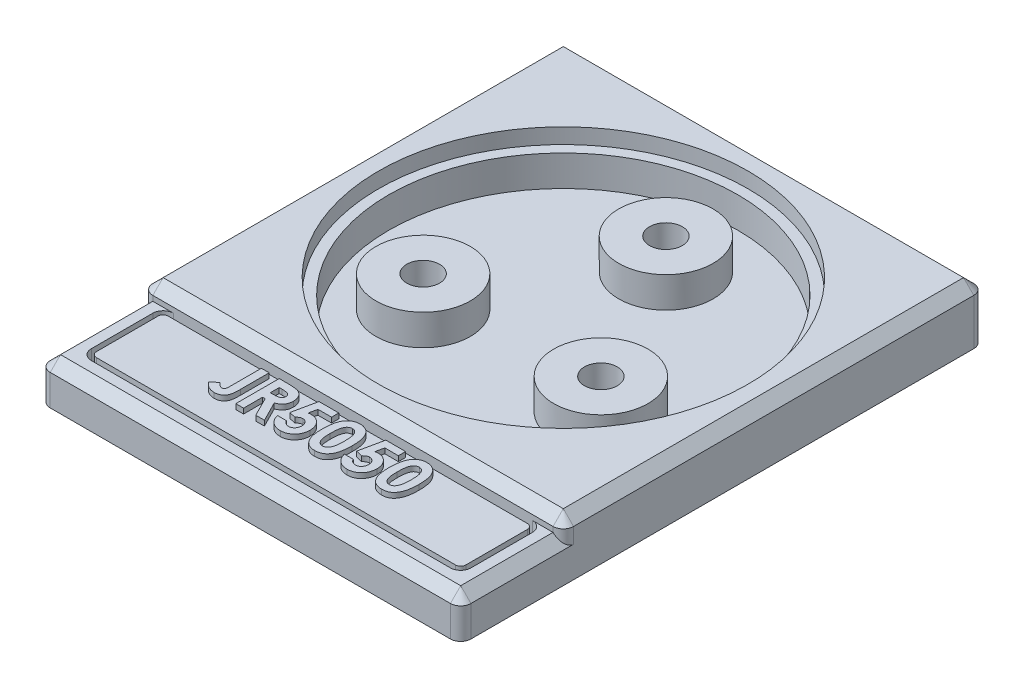
from build123d import *

# Parameters (mm, degrees)
SKETCH3_W           = 41
SKETCH3_H           = 41
SKETCH3_W_2         = 37
SKETCH3_H_2         = 37
SKETCH3_R           = 18
SKETCH3_W_3         = 35
SKETCH3_H_3         = 35
SKETCH3_R_2         = 17
SKETCH3_H_4         = 8
BOSS_EXTRUDE1_DEPTH = 1
BOSS_EXTRUDE2_START = 1
SKETCH3_3_W         = 41
SKETCH3_3_H         = 51
SKETCH3_3_R         = 17
SKETCH3_3_W_2       = 37
SKETCH3_3_H_2       = 8
BOSS_EXTRUDE2_DEPTH = 3
BOSS_EXTRUDE3_START = 4
SKETCH3_4_W         = 41
SKETCH3_4_H         = 41
SKETCH3_4_W_2       = 37
SKETCH3_4_H_2       = 37
SKETCH3_4_R         = 18
BOSS_EXTRUDE3_DEPTH = 1.5
SKETCH4_R           = 4.6
SKETCH4_R_2         = 1.6
BOSS_EXTRUDE4_DEPTH = 3
FILLET1_R           = 1
CHAMFER1_SIZE       = 1
BOSS_EXTRUDE5_START = 0.5
BOSS_EXTRUDE5_DEPTH = 2.5
BOSS_EXTRUDE6_DEPTH = 0.5


with BuildPart() as part:
    # Sketch3 → Boss-Extrude1 (new body)
    # profile 1 of 7: a face of its own
    with BuildSketch(Plane(origin=(0, 0, 0), x_dir=(1, 0, 0), z_dir=(0, 1, 0))):
        Rectangle(SKETCH3_W, SKETCH3_H)
        Rectangle(SKETCH3_W_2, SKETCH3_H_2, mode=Mode.SUBTRACT)
    # profile 2 of 7: a face of its own
    with BuildSketch(Plane(origin=(0, 0, 0), x_dir=(1, 0, 0), z_dir=(0, 1, 0))):
        Rectangle(SKETCH3_W_2, SKETCH3_H_2)
        Circle(SKETCH3_R, mode=Mode.SUBTRACT)
    # profile 3 of 7: a face of its own
    with BuildSketch(Plane(origin=(0, 0, 0), x_dir=(1, 0, 0), z_dir=(0, 1, 0))):
        Rectangle(SKETCH3_W_3, SKETCH3_H_3)
    # profile 4 of 7: a face of its own
    with BuildSketch(Plane(origin=(0, 0, 0), x_dir=(1, 0, 0), z_dir=(0, 1, 0))):
        Circle(SKETCH3_R)
        Circle(SKETCH3_R_2, mode=Mode.SUBTRACT)
    # profile 5 of 7: a face of its own
    with BuildSketch(Plane(origin=(0, 0, 0), x_dir=(1, 0, 0), z_dir=(0, 1, 0))):
        Circle(SKETCH3_R_2)
    # profile 6 of 7: a face of its own
    with BuildSketch(Plane(origin=(0, 0, 0), x_dir=(1, 0, 0), z_dir=(0, 1, 0))):
        with Locations((0, -24.5)):
            Rectangle(SKETCH3_W_2, SKETCH3_H_4)
    # profile 7 of 7: a face of its own
    with BuildSketch(Plane(origin=(0, 0, 0), x_dir=(1, 0, 0), z_dir=(0, 1, 0))):
        Polygon((-18.5, -20.5), (-20.5, -20.5), (-20.5, -30.5), (20.5, -30.5), (20.5, -20.5), (18.5, -20.5), (18.5, -28.5), (-18.5, -28.5), align=None)
    extrude(amount=BOSS_EXTRUDE1_DEPTH)

    # Sketch3<3> → Boss-Extrude2 (add)
    with BuildSketch(Plane(origin=(0, 0, 0), x_dir=(1, 0, 0), z_dir=(0, 1, 0)).offset(BOSS_EXTRUDE2_START)):
        with Locations((0, -5)):
            Rectangle(SKETCH3_3_W, SKETCH3_3_H)
        with Locations(Location((0, 0, 0), (0, 0, 270))):
            Circle(SKETCH3_3_R, mode=Mode.SUBTRACT)
        with Locations((0, -24.5)):
            Rectangle(SKETCH3_3_W_2, SKETCH3_3_H_2, mode=Mode.SUBTRACT)
    extrude(amount=BOSS_EXTRUDE2_DEPTH)

    # Sketch3<4> → Boss-Extrude3 (add)
    # profile 1 of 2: a face of its own
    with BuildSketch(Plane(origin=(0, 0, 0), x_dir=(1, 0, 0), z_dir=(0, 1, 0)).offset(BOSS_EXTRUDE3_START)):
        Rectangle(SKETCH3_4_W, SKETCH3_4_H)
        Rectangle(SKETCH3_4_W_2, SKETCH3_4_H_2, mode=Mode.SUBTRACT)
    # profile 2 of 2: a face of its own
    with BuildSketch(Plane(origin=(0, 0, 0), x_dir=(1, 0, 0), z_dir=(0, 1, 0)).offset(BOSS_EXTRUDE3_START)):
        Rectangle(SKETCH3_4_W_2, SKETCH3_4_H_2)
        with Locations(Location((0, 0, 0), (0, 0, 90))):
            Circle(SKETCH3_4_R, mode=Mode.SUBTRACT)
    extrude(amount=BOSS_EXTRUDE3_DEPTH)

    # Sketch4 → Boss-Extrude4 (add)
    # profile 1 of 3: a face of its own
    with BuildSketch(Plane(origin=(0, 1, 0), x_dir=(1, 0, 0), z_dir=(0, 1, 0))):
        with Locations(Location((0, 10, 0), (0, 0, 90))):
            Circle(SKETCH4_R)
        with Locations(Location((0, 10, 0), (0, 0, 90))):
            Circle(SKETCH4_R_2, mode=Mode.SUBTRACT)
    # profile 2 of 3: a face of its own
    with BuildSketch(Plane(origin=(0, 1, 0), x_dir=(1, 0, 0), z_dir=(0, 1, 0))):
        with Locations(Location((-8.660254038, -5, 0), (0, 0, 90))):
            Circle(SKETCH4_R)
        with Locations(Location((-8.660254038, -5, 0), (0, 0, 90))):
            Circle(SKETCH4_R_2, mode=Mode.SUBTRACT)
    # profile 3 of 3: a face of its own
    with BuildSketch(Plane(origin=(0, 1, 0), x_dir=(1, 0, 0), z_dir=(0, 1, 0))):
        with Locations(Location((8.660254038, -5, 0), (0, 0, 90))):
            Circle(SKETCH4_R)
        with Locations(Location((8.660254038, -5, 0), (0, 0, 90))):
            Circle(SKETCH4_R_2, mode=Mode.SUBTRACT)
    extrude(amount=BOSS_EXTRUDE4_DEPTH)

    # Fillet1
    fillet1_edges = [part.edges().sort_by_distance(p)[0] for p in [
        (20.5, 2.75, -20.5),
        (18.5, 2.5, 20.5),
        (-18.5, 2.5, 20.5),
        (-18.5, 2.5, 28.5),
        (18.5, 2.5, 28.5),
        (20.5, 4.75, 20.5),
        (-20.5, 4.75, 20.5),
        (20.5, 2, 30.5),
        (-20.5, 2, 30.5),
        (-20.5, 2.75, -20.5),
    ]]
    fillet(fillet1_edges, radius=FILLET1_R)

    # Chamfer1
    chamfer1_edges = [part.edges().sort_by_distance(p)[0] for p in [
        (-20.5, 5.5, 0),
        (-20.207106781, 5.5, 20.207106781),
        (-20.207106781, 5.5, -20.207106781),
        (0, 5.5, 20.5),
        (0, 5.5, -20.5),
        (20.207106781, 5.5, 20.207106781),
        (20.207106781, 5.5, -20.207106781),
        (20.5, 5.5, 0),
        (-20.5, 4, 24.5),
        (-20.207106781, 4, 30.207106781),
        (0, 4, 30.5),
        (20.207106781, 4, 30.207106781),
        (20.5, 4, 24.5),
    ]]
    chamfer(chamfer1_edges, length=CHAMFER1_SIZE - 0.0001)  # a hair under: the kernel refuses the full size


with BuildPart() as body_2:
    # Sketch5 → Boss-Extrude5 (new body)
    with BuildSketch(Plane(origin=(0, 1, 0), x_dir=(1, 0, 0), z_dir=(0, 1, 0)).offset(BOSS_EXTRUDE5_START)):
        with BuildLine():
            Line((-18, -21.5), (-18, -27.5))
            ThreePointArc((-18, -27.5), (-17.853553391, -27.853553391), (-17.5, -28))
            Line((-17.5, -28), (17.5, -28))
            ThreePointArc((17.5, -28), (17.853553391, -27.853553391), (18, -27.5))
            Line((18, -27.5), (18, -21.5))
            ThreePointArc((18, -21.5), (17.853553391, -21.146446609), (17.5, -21))
            Line((17.5, -21), (-17.5, -21))
            ThreePointArc((-17.5, -21), (-17.853553391, -21.146446609), (-18, -21.5))
        make_face()
    extrude(amount=BOSS_EXTRUDE5_DEPTH)

    # Sketch6 → Boss-Extrude6 (add)
    # profile 1 of 6: a face of its own
    with BuildSketch(Plane(origin=(0, 4, 0), x_dir=(1, 0, 0), z_dir=(0, 1, 0))):
        with BuildLine():
            Line((-8.059615385, -21.362535969), (-7.299786325, -21.362535969))
            Line((-7.299786325, -21.362535969), (-7.299786325, -24.172885862))
            add(Edge.make_bspline(
                [(-7.299786325, -24.172885862), (-7.300064901, -24.226599249), (-7.300601662, -24.33009434), (-7.305975594, -24.479089066), (-7.313242098, -24.615694994), (-7.323706564, -24.739693237), (-7.339249161, -24.851077799), (-7.356838662, -24.950126573), (-7.376244764, -25.037243156), (-7.409026432, -25.134740166), (-7.459919022, -25.242707014), (-7.536717394, -25.359326552), (-7.632355947, -25.460649059), (-7.74249997, -25.548659368), (-7.868077507, -25.618346884), (-8.006195547, -25.668717207), (-8.15641256, -25.698808787), (-8.26045673, -25.702510523), (-8.314022436, -25.704416311)],
                knots=[0, 0, 0, 0, 1.22248561, 2.355488409, 3.392943897, 4.335991845, 5.186735882, 5.951517034, 6.625683685, 7.215700098, 8.28923535, 9.333114649, 10.380102123, 11.447198135, 12.530158036, 13.633358744, 14.781567393, 16, 16, 16, 16], degree=3))
            add(Edge.make_bspline(
                [(-8.314022436, -25.704416311), (-8.369833027, -25.702688479), (-8.479913307, -25.69928052), (-8.641357374, -25.670253463), (-8.796525305, -25.623714356), (-8.944614341, -25.556424392), (-9.087653347, -25.472134621), (-9.223046297, -25.367581365), (-9.353620009, -25.246007278), (-9.431024903, -25.152714374), (-9.470726496, -25.104863693)],
                knots=[0, 0, 0, 0, 0.990984786, 1.954608977, 2.90473533, 3.862451285, 4.837525908, 5.848096122, 6.896271184, 8, 8, 8, 8], degree=3))
            Line((-9.470726496, -25.104863693), (-8.89576656, -24.573152956))
            add(Edge.make_bspline(
                [(-8.89576656, -24.573152956), (-8.865662307, -24.607192365), (-8.809329155, -24.67088925), (-8.724436757, -24.753951553), (-8.64785924, -24.820682526), (-8.575671989, -24.868816178), (-8.507550611, -24.902745029), (-8.442029429, -24.927184934), (-8.377066052, -24.941019308), (-8.334149264, -24.943415939), (-8.313174412, -24.944587251)],
                knots=[0, 0, 0, 0, 1.529509877, 2.862124173, 3.996688592, 4.944357383, 5.774364335, 6.554177287, 7.293378699, 8, 8, 8, 8], degree=3))
            add(Edge.make_bspline(
                [(-8.313174412, -24.944587251), (-8.292873091, -24.94352857), (-8.253840324, -24.941493074), (-8.200168772, -24.918865957), (-8.154920201, -24.883340431), (-8.125131212, -24.842499229), (-8.106147742, -24.800748526), (-8.094286512, -24.760390053), (-8.083030185, -24.712011182), (-8.074011866, -24.655636161), (-8.067197608, -24.590529654), (-8.063801194, -24.51748205), (-8.059670718, -24.436098612), (-8.059634485, -24.379245218), (-8.059615385, -24.349274751)],
                knots=[0, 0, 0, 0, 1.003927327, 1.930222208, 2.840933547, 3.835773585, 4.407906147, 5.114514582, 5.922289074, 6.876303333, 7.950072246, 9.174518422, 10.510537432, 12, 12, 12, 12], degree=3))
            Line((-8.059615385, -24.349274751), (-8.059615385, -21.362535969))
        make_face()
    # profile 2 of 6: a face of its own
    with BuildSketch(Plane(origin=(0, 4, 0), x_dir=(1, 0, 0), z_dir=(0, 1, 0))):
        with BuildLine():
            Line((-6.322863248, -21.362535969), (-5.437526709, -21.362535969))
            add(Edge.make_bspline(
                [(-5.437526709, -21.362535969), (-5.379006234, -21.362743683), (-5.266454875, -21.363143176), (-5.104161962, -21.369446113), (-4.955073603, -21.378217167), (-4.818969059, -21.391602029), (-4.695906557, -21.409348737), (-4.58576276, -21.43026917), (-4.488540888, -21.454112488), (-4.403421007, -21.483823144), (-4.326604525, -21.517336314), (-4.255000883, -21.55584356), (-4.1870304, -21.598916092), (-4.123147385, -21.647687266), (-4.062796679, -21.701279699), (-4.005864427, -21.759747339), (-3.953155134, -21.823585966), (-3.90499518, -21.892392201), (-3.861101258, -21.964774783), (-3.822308237, -22.040833093), (-3.790761688, -22.120620024), (-3.76288693, -22.202982484), (-3.742809645, -22.289097859), (-3.728846187, -22.378127802), (-3.718622689, -22.470385707), (-3.718034887, -22.533061632), (-3.717735043, -22.565033298)],
                knots=[0, 0, 0, 0, 1.749336639, 3.364467119, 4.854658419, 6.213483162, 7.451590619, 8.570285859, 9.5643256, 10.440900261, 11.26203566, 12.067320669, 12.869050712, 13.665104639, 14.467235401, 15.27997916, 16.102287765, 16.939272006, 17.78853747, 18.631303466, 19.488103222, 20.351255419, 21.228522269, 22.127379805, 23.044756219, 24, 24, 24, 24], degree=3))
            add(Edge.make_bspline(
                [(-3.717735043, -22.565033298), (-3.71851393, -22.598404373), (-3.720041187, -22.663838968), (-3.728267822, -22.759957052), (-3.743303526, -22.851916111), (-3.766077288, -22.939446901), (-3.792252769, -23.023638845), (-3.827059444, -23.102938548), (-3.866342217, -23.17849931), (-3.912997219, -23.249252295), (-3.964198805, -23.316769068), (-4.023745172, -23.378462812), (-4.08777863, -23.437649331), (-4.159898734, -23.490621383), (-4.236926362, -23.540960746), (-4.320391972, -23.586581616), (-4.409750839, -23.628630794), (-4.472574547, -23.65208032), (-4.504700855, -23.66407176)],
                knots=[0, 0, 0, 0, 1.099860209, 2.156625411, 3.176576793, 4.16617041, 5.135385252, 6.078461593, 7.016046972, 7.938469504, 8.868247731, 9.803980173, 10.76021508, 11.73834243, 12.748633912, 13.790971185, 14.870363756, 16, 16, 16, 16], degree=3))
            Line((-4.504700855, -23.66407176), (-3.527777778, -25.595869302))
            Line((-3.527777778, -25.595869302), (-4.372409188, -25.595869302))
            Line((-4.372409188, -25.595869302), (-5.305235043, -23.750570157))
            Line((-5.305235043, -23.750570157), (-5.563034188, -23.750570157))
            Line((-5.563034188, -23.750570157), (-5.563034188, -25.595869302))
            Line((-5.563034188, -25.595869302), (-6.322863248, -25.595869302))
            Line((-6.322863248, -25.595869302), (-6.322863248, -21.362535969))
        make_face()
        with BuildLine():
            Line((-5.563034188, -22.990741097), (-5.267073985, -22.990741097))
            add(Edge.make_bspline(
                [(-5.267073985, -22.990741097), (-5.23089039, -22.990333573), (-5.161606581, -22.989553252), (-5.061967363, -22.985933801), (-4.97147119, -22.977212712), (-4.889729442, -22.966193941), (-4.816330801, -22.953471179), (-4.751929957, -22.935238689), (-4.695534591, -22.915702114), (-4.647812992, -22.891423219), (-4.607040753, -22.863812849), (-4.571836535, -22.832446784), (-4.542717599, -22.796144556), (-4.518751229, -22.755892705), (-4.500107999, -22.711335213), (-4.48649987, -22.66296122), (-4.478894938, -22.610219684), (-4.478019964, -22.573820843), (-4.477564103, -22.554857016)],
                knots=[0, 0, 0, 0, 1.688639943, 3.233382647, 4.650958383, 5.928841754, 7.082724185, 8.122798841, 9.049171256, 9.863274652, 10.613301712, 11.341792392, 12.054588806, 12.776240173, 13.521029143, 14.301969904, 15.115324896, 16, 16, 16, 16], degree=3))
            add(Edge.make_bspline(
                [(-4.477564103, -22.554857016), (-4.478425951, -22.532421425), (-4.480118893, -22.488350862), (-4.496918135, -22.424904706), (-4.523658901, -22.366180948), (-4.560313166, -22.312444915), (-4.606474447, -22.2653362), (-4.659448159, -22.223809492), (-4.720377603, -22.190973279), (-4.776793684, -22.169314862), (-4.82811913, -22.156356408), (-4.874438726, -22.146699882), (-4.928077096, -22.139856026), (-4.989074736, -22.132596897), (-5.05727616, -22.12788972), (-5.133053107, -22.124454419), (-5.216187945, -22.123048868), (-5.274140823, -22.122599539), (-5.304387019, -22.122365029)],
                knots=[0, 0, 0, 0, 1.020303359, 2.004196876, 2.966617323, 3.9489082, 4.950758222, 5.960522915, 7.003732012, 8.091992268, 8.70421221, 9.413913587, 10.24622431, 11.166358409, 12.212345909, 13.359657661, 14.621978493, 16, 16, 16, 16], degree=3))
            Line((-5.304387019, -22.122365029), (-5.563034188, -22.122365029))
            Line((-5.563034188, -22.122365029), (-5.563034188, -22.990741097))
        make_face(mode=Mode.SUBTRACT)
    # profile 3 of 6: a face of its own
    with BuildSketch(Plane(origin=(0, 4, 0), x_dir=(1, 0, 0), z_dir=(0, 1, 0))):
        with BuildLine():
            Line((-2.443155716, -21.362535969), (-0.515598291, -21.362535969))
            Line((-0.515598291, -21.362535969), (-0.515598291, -22.068091525))
            Line((-0.515598291, -22.068091525), (-1.841059028, -22.068091525))
            Line((-1.841059028, -22.068091525), (-2.006423611, -22.868625713))
            add(Edge.make_bspline(
                [(-2.006423611, -22.868625713), (-1.983890319, -22.862349906), (-1.939450039, -22.849972727), (-1.872500701, -22.837559983), (-1.807617462, -22.829514436), (-1.765041477, -22.828441267), (-1.744384348, -22.827920584)],
                knots=[0, 0, 0, 0, 1.05461699, 2.079921384, 3.068411212, 4, 4, 4, 4], degree=3))
            add(Edge.make_bspline(
                [(-1.744384348, -22.827920584), (-1.699370302, -22.828952055), (-1.610637699, -22.830985311), (-1.480833162, -22.850287544), (-1.356537649, -22.880687977), (-1.238131519, -22.924045265), (-1.125730439, -22.980475895), (-1.019198156, -23.04874114), (-0.91840392, -23.128960897), (-0.825138261, -23.22118539), (-0.739441878, -23.322449972), (-0.66493376, -23.431978332), (-0.601299178, -23.548208703), (-0.550686431, -23.67186357), (-0.510738536, -23.802166297), (-0.481871296, -23.939200386), (-0.464800654, -24.083128243), (-0.462498783, -24.18131993), (-0.461324786, -24.231399484)],
                knots=[0, 0, 0, 0, 1.01440847, 1.999622559, 2.951875003, 3.895578053, 4.836219714, 5.782137149, 6.743708247, 7.735272588, 8.734977101, 9.730283169, 10.717124674, 11.717316708, 12.737475749, 13.78628267, 14.87096371, 16, 16, 16, 16], degree=3))
            add(Edge.make_bspline(
                [(-0.461324786, -24.231399484), (-0.462759429, -24.282047557), (-0.465590398, -24.381991011), (-0.484059877, -24.528943241), (-0.51665884, -24.669690302), (-0.561436776, -24.804608971), (-0.620428841, -24.932707628), (-0.691374874, -25.055313279), (-0.775474379, -25.171515863), (-0.871902053, -25.280124161), (-0.976731583, -25.37939423), (-1.088350287, -25.4667223), (-1.20597401, -25.540208164), (-1.329605589, -25.599597165), (-1.458535712, -25.646584686), (-1.592803509, -25.680789358), (-1.733061506, -25.700403837), (-1.828278461, -25.703064122), (-1.876676015, -25.704416311)],
                knots=[0, 0, 0, 0, 1.06808661, 2.107647099, 3.116961351, 4.110378221, 5.100014249, 6.085620622, 7.093190682, 8.119403071, 9.144090782, 10.133780668, 11.103064255, 12.062861538, 13.020824475, 13.992378307, 14.979551724, 16, 16, 16, 16], degree=3))
            add(Edge.make_bspline(
                [(-1.876676015, -25.704416311), (-1.919956506, -25.703310136), (-2.005314693, -25.701128529), (-2.131043555, -25.687719219), (-2.252260139, -25.664011433), (-2.368320919, -25.629700128), (-2.480447047, -25.587470745), (-2.587342314, -25.53465492), (-2.689594128, -25.472258339), (-2.786912132, -25.401419741), (-2.877715046, -25.321622807), (-2.960590325, -25.234271314), (-3.036039705, -25.140466286), (-3.102448688, -25.039050452), (-3.159609103, -24.93017365), (-3.210300124, -24.815119017), (-3.251791233, -24.692685016), (-3.272846776, -24.607806965), (-3.283547009, -24.564672721)],
                knots=[0, 0, 0, 0, 1.054957082, 2.080596141, 3.077793124, 4.061112343, 5.027190972, 5.994718051, 6.962465889, 7.943658696, 8.924948258, 9.904494768, 10.875059, 11.855380583, 12.854004648, 13.869083016, 14.917087635, 16, 16, 16, 16], degree=3))
            Line((-3.283547009, -24.564672721), (-2.41517094, -24.564672721))
            add(Edge.make_bspline(
                [(-2.41517094, -24.564672721), (-2.399297005, -24.594562995), (-2.368447823, -24.652651332), (-2.309765858, -24.729772327), (-2.244075124, -24.795537799), (-2.171968188, -24.850590289), (-2.09297784, -24.891834678), (-2.010322788, -24.923112515), (-1.922964672, -24.941186818), (-1.863469939, -24.943446285), (-1.833426816, -24.944587251)],
                knots=[0, 0, 0, 0, 1.104910296, 2.147267069, 3.153527244, 4.136738762, 5.099945312, 6.05603338, 7.018353, 8, 8, 8, 8], degree=3))
            add(Edge.make_bspline(
                [(-1.833426816, -24.944587251), (-1.812487163, -24.943799404), (-1.771288042, -24.942249303), (-1.710587653, -24.934048876), (-1.652646465, -24.918517453), (-1.597033698, -24.897010043), (-1.543599964, -24.870187873), (-1.493111253, -24.836326632), (-1.444689152, -24.797351087), (-1.399070842, -24.752626518), (-1.357753803, -24.702769027), (-1.321523279, -24.649193753), (-1.289128194, -24.593091152), (-1.265132659, -24.532238859), (-1.245482345, -24.468453943), (-1.231011059, -24.401255257), (-1.222362834, -24.330564318), (-1.221562239, -24.282305595), (-1.221153846, -24.257688213)],
                knots=[0, 0, 0, 0, 0.978869489, 1.925942215, 2.855067702, 3.774946051, 4.70828698, 5.642468714, 6.60995405, 7.609372294, 8.622401667, 9.629904756, 10.629323, 11.642352373, 12.678539694, 13.745912462, 14.850161547, 16, 16, 16, 16], degree=3))
            add(Edge.make_bspline(
                [(-1.221153846, -24.257688213), (-1.221627834, -24.233642256), (-1.222550462, -24.186836216), (-1.230182628, -24.118108185), (-1.243836427, -24.052897721), (-1.262439845, -23.990705361), (-1.28625444, -23.931908768), (-1.315357468, -23.876157956), (-1.349873259, -23.823734724), (-1.389987122, -23.775706358), (-1.432764132, -23.731653376), (-1.478720386, -23.693124988), (-1.527441843, -23.661149101), (-1.577414543, -23.633233222), (-1.630633218, -23.612916653), (-1.685901192, -23.598925382), (-1.743160344, -23.58865915), (-1.782215569, -23.588055971), (-1.802049947, -23.587749644)],
                knots=[0, 0, 0, 0, 1.166249705, 2.270133367, 3.348514167, 4.393962215, 5.415026464, 6.420877785, 7.440098956, 8.453121383, 9.451844239, 10.415694839, 11.355045125, 12.27538808, 13.187007209, 14.108269027, 15.039275622, 16, 16, 16, 16], degree=3))
            add(Edge.make_bspline(
                [(-1.802049947, -23.587749644), (-1.823594691, -23.588567148), (-1.86677498, -23.5902056), (-1.930930082, -23.603537247), (-1.994311652, -23.625112853), (-2.057272157, -23.65487982), (-2.119186604, -23.693835389), (-2.181688946, -23.739525804), (-2.242687096, -23.795270908), (-2.281471416, -23.836789989), (-2.301535791, -23.858269142)],
                knots=[0, 0, 0, 0, 0.88288272, 1.769486374, 2.674910571, 3.623812639, 4.617874466, 5.670434592, 6.794841017, 8, 8, 8, 8], degree=3))
            Line((-2.301535791, -23.858269142), (-2.940945513, -23.711561076))
            Line((-2.940945513, -23.711561076), (-2.443155716, -21.362535969))
        make_face()
    # profile 4 of 6: a face of its own
    with BuildSketch(Plane(origin=(0, 4, 0), x_dir=(1, 0, 0), z_dir=(0, 1, 0))):
        with BuildLine():
            add(Edge.make_bspline(
                [(1.452664263, -21.253988961), (1.489443143, -21.254534953), (1.561760248, -21.255608521), (1.668269731, -21.267236135), (1.770867811, -21.284802217), (1.869955865, -21.309300775), (1.964820646, -21.341723745), (2.056152601, -21.380533483), (2.142864615, -21.427765642), (2.226062542, -21.481116791), (2.305714335, -21.541517855), (2.379905619, -21.610378186), (2.449991284, -21.686113306), (2.514454234, -21.769868194), (2.574722021, -21.86088101), (2.630596614, -21.959166185), (2.68165028, -22.065204761), (2.728455208, -22.179188092), (2.770308323, -22.302824739), (2.805561149, -22.437532868), (2.835796347, -22.583343241), (2.861316987, -22.740618804), (2.880606466, -22.909568612), (2.893607964, -23.090080424), (2.902530207, -23.28180624), (2.903258378, -23.413328575), (2.903632479, -23.480898683)],
                knots=[0, 0, 0, 0, 0.879237366, 1.728815576, 2.559023295, 3.367336655, 4.166867292, 4.954216142, 5.737608147, 6.525189134, 7.316157332, 8.124696809, 8.942788509, 9.781158001, 10.649253743, 11.551476218, 12.482711956, 13.461909668, 14.496590415, 15.601789533, 16.789733467, 18.056700938, 19.410929216, 20.8549011, 22.384193279, 24, 24, 24, 24], degree=3))
            add(Edge.make_bspline(
                [(2.903632479, -23.480898683), (2.903228177, -23.549314169), (2.902442625, -23.682244231), (2.893978864, -23.875723668), (2.879403867, -24.057546105), (2.860618558, -24.227692729), (2.834887825, -24.38607369), (2.804753559, -24.533099086), (2.768944277, -24.668715627), (2.725712534, -24.792617737), (2.679190917, -24.906801248), (2.627997597, -25.012633074), (2.573024868, -25.110399866), (2.515533637, -25.20157657), (2.452372023, -25.283475342), (2.386614282, -25.358881169), (2.315397202, -25.424921747), (2.241719299, -25.48500051), (2.162881453, -25.536920617), (2.079696698, -25.582329088), (1.990681994, -25.61916075), (1.897459928, -25.651194963), (1.79844151, -25.674192072), (1.69520013, -25.692439521), (1.586570214, -25.702524181), (1.512610592, -25.70377525), (1.474712874, -25.704416311)],
                knots=[0, 0, 0, 0, 1.643780988, 3.193836972, 4.651895693, 6.025988579, 7.305620092, 8.505800249, 9.631074763, 10.672816429, 11.65661981, 12.592235626, 13.49536222, 14.350718032, 15.179365177, 15.97804903, 16.751647189, 17.51006938, 18.259804725, 19.016521909, 19.783502495, 20.571750527, 21.382245291, 22.22305063, 23.089471752, 24, 24, 24, 24], degree=3))
            add(Edge.make_bspline(
                [(1.474712874, -25.704416311), (1.436816179, -25.703762884), (1.362577112, -25.702482831), (1.253653449, -25.692514505), (1.149864942, -25.674118151), (1.05006313, -25.651018409), (0.954942617, -25.619231629), (0.864047304, -25.58129799), (0.778076097, -25.536172846), (0.696790955, -25.484131769), (0.62046941, -25.424454978), (0.547925423, -25.357780784), (0.479319468, -25.284278188), (0.415695211, -25.203123901), (0.35601067, -25.115401162), (0.30088826, -25.020108222), (0.25036111, -24.917383823), (0.20284872, -24.80708478), (0.161566468, -24.686836479), (0.12482718, -24.55556512), (0.094731322, -24.412176446), (0.070526219, -24.256716524), (0.051200878, -24.089514701), (0.036825046, -23.910490274), (0.028314272, -23.719559858), (0.027536959, -23.588323873), (0.027136752, -23.520755787)],
                knots=[0, 0, 0, 0, 0.917216111, 1.796812873, 2.643793957, 3.46689424, 4.273913431, 5.068098542, 5.848489301, 6.620921603, 7.401012384, 8.190319798, 9.003608147, 9.831726257, 10.68377682, 11.569763213, 12.493818149, 13.453288342, 14.474581811, 15.568529029, 16.750744269, 18.018426408, 19.375425659, 20.823733699, 22.36466933, 24, 24, 24, 24], degree=3))
            add(Edge.make_bspline(
                [(0.027136752, -23.520755787), (0.02786169, -23.426875252), (0.029260466, -23.24573155), (0.046986788, -22.984031569), (0.073004532, -22.742135268), (0.111218436, -22.520447283), (0.158469399, -22.318146544), (0.218976718, -22.136565704), (0.287859898, -21.973192183), (0.346557218, -21.876408726), (0.374826389, -21.82979692)],
                knots=[0, 0, 0, 0, 1.288568992, 2.486310467, 3.599230591, 4.627010532, 5.572937695, 6.447898582, 7.252493626, 8, 8, 8, 8], degree=3))
            add(Edge.make_bspline(
                [(0.374826389, -21.82979692), (0.407696434, -21.784005496), (0.471963851, -21.694474238), (0.584337224, -21.576936433), (0.705067783, -21.476412346), (0.836635264, -21.395176928), (0.976958874, -21.331114671), (1.12724336, -21.28586822), (1.286933749, -21.25950553), (1.396595802, -21.255855277), (1.452664263, -21.253988961)],
                knots=[0, 0, 0, 0, 1.058512271, 2.069600068, 3.047294572, 4.004278952, 4.967380941, 5.939006123, 6.946246673, 8, 8, 8, 8], degree=3))
        make_face()
        with BuildLine():
            add(Edge.make_bspline(
                [(1.47132078, -22.01381802), (1.438072367, -22.015393929), (1.372887829, -22.018483547), (1.278301959, -22.04471004), (1.189113388, -22.085218274), (1.121270025, -22.133963599), (1.070489942, -22.180691839), (1.035009534, -22.222979377), (1.000794273, -22.270169221), (0.970573631, -22.324390808), (0.942037456, -22.38369589), (0.914149012, -22.448353678), (0.891287811, -22.519952306), (0.868827287, -22.597272441), (0.849149773, -22.68245178), (0.832664329, -22.776186569), (0.817936035, -22.879086374), (0.807662874, -22.991218595), (0.798085204, -23.112465914), (0.791219478, -23.243098423), (0.78834909, -23.383080879), (0.787436681, -23.47948472), (0.786965812, -23.529236022)],
                knots=[0, 0, 0, 0, 1.076674018, 2.110852608, 3.161083442, 4.239746716, 4.804137807, 5.395870207, 6.026861976, 6.692161227, 7.405688833, 8.16177676, 8.973626916, 9.841385931, 10.773283133, 11.807421078, 12.927755683, 14.143907515, 15.458935494, 16.872852025, 18.386167141, 20, 20, 20, 20], degree=3))
            add(Edge.make_bspline(
                [(0.786965812, -23.529236022), (0.787740804, -23.59369124), (0.78922691, -23.717288899), (0.797010437, -23.895026636), (0.81261187, -24.056782289), (0.832016902, -24.203652135), (0.859272063, -24.334683685), (0.89063089, -24.451116617), (0.929356253, -24.551466696), (0.974110872, -24.637185208), (1.023678628, -24.710105769), (1.077486608, -24.772088574), (1.133702843, -24.825762758), (1.194082024, -24.869361637), (1.258480105, -24.902773808), (1.32635948, -24.92680677), (1.397763285, -24.941518347), (1.446659875, -24.943558369), (1.47132078, -24.944587251)],
                knots=[0, 0, 0, 0, 1.771748488, 3.397459088, 4.888034009, 6.237357457, 7.467047327, 8.564189669, 9.548206622, 10.417051504, 11.216568818, 11.965764335, 12.669334354, 13.348544111, 14.005342236, 14.656555988, 15.322436492, 16, 16, 16, 16], degree=3))
            add(Edge.make_bspline(
                [(1.47132078, -24.944587251), (1.495135401, -24.943883214), (1.541761467, -24.942504796), (1.609752714, -24.928355526), (1.674050068, -24.905351885), (1.734459396, -24.872811621), (1.791196773, -24.831431695), (1.843984902, -24.781030269), (1.892425666, -24.721104955), (1.920647475, -24.67663151), (1.935189637, -24.653715189)],
                knots=[0, 0, 0, 0, 0.992283464, 1.942767638, 2.88273346, 3.832339453, 4.79467288, 5.803907806, 6.868395428, 8, 8, 8, 8], degree=3))
            add(Edge.make_bspline(
                [(1.935189637, -24.653715189), (1.952310583, -24.622400769), (1.988211819, -24.556736969), (2.029756791, -24.445931755), (2.064727034, -24.320961787), (2.09482541, -24.181438147), (2.115410863, -24.026810537), (2.13313903, -23.858059463), (2.141689766, -23.674335163), (2.143080589, -23.547050305), (2.143803419, -23.480898683)],
                knots=[0, 0, 0, 0, 0.710965849, 1.490837728, 2.352621235, 3.297892224, 4.334225155, 5.461620853, 6.680770821, 8, 8, 8, 8], degree=3))
            add(Edge.make_bspline(
                [(2.143803419, -23.480898683), (2.143524205, -23.414172833), (2.142986767, -23.285736962), (2.133126334, -23.10135216), (2.119394927, -22.932947245), (2.099309842, -22.780898196), (2.07346673, -22.644835906), (2.041614997, -22.524769267), (2.004064173, -22.420461653), (1.959533371, -22.332017073), (1.910212741, -22.256851312), (1.857857387, -22.192364919), (1.802245928, -22.137308064), (1.743471366, -22.091473558), (1.680173343, -22.056452557), (1.613560932, -22.031724834), (1.543497575, -22.016765391), (1.495704446, -22.014813738), (1.47132078, -22.01381802)],
                knots=[0, 0, 0, 0, 1.793836731, 3.452829483, 4.963243077, 6.335886805, 7.574563692, 8.684454726, 9.672768357, 10.54971625, 11.340229787, 12.085688095, 12.778991901, 13.440269426, 14.083255152, 14.715733572, 15.344777694, 16, 16, 16, 16], degree=3))
        make_face(mode=Mode.SUBTRACT)
    # profile 5 of 6: a face of its own
    with BuildSketch(Plane(origin=(0, 4, 0), x_dir=(1, 0, 0), z_dir=(0, 1, 0))):
        with BuildLine():
            Line((4.069664797, -21.362535969), (5.997222222, -21.362535969))
            Line((5.997222222, -21.362535969), (5.997222222, -22.068091525))
            Line((5.997222222, -22.068091525), (4.671761485, -22.068091525))
            Line((4.671761485, -22.068091525), (4.506396902, -22.868625713))
            add(Edge.make_bspline(
                [(4.506396902, -22.868625713), (4.528930193, -22.862349906), (4.573370474, -22.849972727), (4.640319812, -22.837559983), (4.705203051, -22.829514436), (4.747779036, -22.828441267), (4.768436165, -22.827920584)],
                knots=[0, 0, 0, 0, 1.05461699, 2.079921384, 3.068411212, 4, 4, 4, 4], degree=3))
            add(Edge.make_bspline(
                [(4.768436165, -22.827920584), (4.813450211, -22.828952055), (4.902182814, -22.830985311), (5.031987351, -22.850287544), (5.156282864, -22.880687977), (5.274688993, -22.924045265), (5.387090074, -22.980475895), (5.493622357, -23.04874114), (5.594416593, -23.128960897), (5.687682252, -23.22118539), (5.773378635, -23.322449972), (5.847886753, -23.431978332), (5.911521335, -23.548208703), (5.962134082, -23.67186357), (6.002081976, -23.802166297), (6.030949217, -23.939200386), (6.048019859, -24.083128243), (6.05032173, -24.18131993), (6.051495726, -24.231399484)],
                knots=[0, 0, 0, 0, 1.01440847, 1.999622559, 2.951875003, 3.895578053, 4.836219714, 5.782137149, 6.743708247, 7.735272588, 8.734977101, 9.730283169, 10.717124674, 11.717316708, 12.737475749, 13.78628267, 14.87096371, 16, 16, 16, 16], degree=3))
            add(Edge.make_bspline(
                [(6.051495726, -24.231399484), (6.050061084, -24.282047557), (6.047230115, -24.381991011), (6.028760636, -24.528943241), (5.996161673, -24.669690302), (5.951383737, -24.804608971), (5.892391671, -24.932707628), (5.821445639, -25.055313279), (5.737346134, -25.171515863), (5.64091846, -25.280124161), (5.53608893, -25.37939423), (5.424470226, -25.4667223), (5.306846503, -25.540208164), (5.183214923, -25.599597165), (5.054284801, -25.646584686), (4.920017003, -25.680789358), (4.779759007, -25.700403837), (4.684542051, -25.703064122), (4.636144498, -25.704416311)],
                knots=[0, 0, 0, 0, 1.06808661, 2.107647099, 3.116961351, 4.110378221, 5.100014249, 6.085620622, 7.093190682, 8.119403071, 9.144090782, 10.133780668, 11.103064255, 12.062861538, 13.020824475, 13.992378307, 14.979551724, 16, 16, 16, 16], degree=3))
            add(Edge.make_bspline(
                [(4.636144498, -25.704416311), (4.592864006, -25.703310136), (4.50750582, -25.701128529), (4.381776958, -25.687719219), (4.260560374, -25.664011433), (4.144499594, -25.629700128), (4.032373465, -25.587470745), (3.925478198, -25.53465492), (3.823226385, -25.472258339), (3.725908381, -25.401419741), (3.635105467, -25.321622807), (3.552230188, -25.234271314), (3.476780808, -25.140466286), (3.410371825, -25.039050452), (3.35321141, -24.93017365), (3.302520389, -24.815119017), (3.26102928, -24.692685016), (3.239973737, -24.607806965), (3.229273504, -24.564672721)],
                knots=[0, 0, 0, 0, 1.054957082, 2.080596141, 3.077793124, 4.061112343, 5.027190972, 5.994718051, 6.962465889, 7.943658696, 8.924948258, 9.904494768, 10.875059, 11.855380583, 12.854004648, 13.869083016, 14.917087635, 16, 16, 16, 16], degree=3))
            Line((3.229273504, -24.564672721), (4.097649573, -24.564672721))
            add(Edge.make_bspline(
                [(4.097649573, -24.564672721), (4.113523508, -24.594562995), (4.14437269, -24.652651332), (4.203054655, -24.729772327), (4.268745388, -24.795537799), (4.340852325, -24.850590289), (4.419842673, -24.891834678), (4.502497725, -24.923112515), (4.58985584, -24.941186818), (4.649350574, -24.943446285), (4.679393697, -24.944587251)],
                knots=[0, 0, 0, 0, 1.104910296, 2.147267069, 3.153527244, 4.136738762, 5.099945312, 6.05603338, 7.018353, 8, 8, 8, 8], degree=3))
            add(Edge.make_bspline(
                [(4.679393697, -24.944587251), (4.70033335, -24.943799404), (4.74153247, -24.942249303), (4.80223286, -24.934048876), (4.860174048, -24.918517453), (4.915786815, -24.897010043), (4.969220549, -24.870187873), (5.01970926, -24.836326632), (5.068131361, -24.797351087), (5.11374967, -24.752626518), (5.15506671, -24.702769027), (5.191297234, -24.649193753), (5.223692319, -24.593091152), (5.247687854, -24.532238859), (5.267338168, -24.468453943), (5.281809454, -24.401255257), (5.290457679, -24.330564318), (5.291258273, -24.282305595), (5.291666667, -24.257688213)],
                knots=[0, 0, 0, 0, 0.978869489, 1.925942215, 2.855067702, 3.774946051, 4.70828698, 5.642468714, 6.60995405, 7.609372294, 8.622401667, 9.629904756, 10.629323, 11.642352373, 12.678539694, 13.745912462, 14.850161547, 16, 16, 16, 16], degree=3))
            add(Edge.make_bspline(
                [(5.291666667, -24.257688213), (5.291192679, -24.233642256), (5.290270051, -24.186836216), (5.282637884, -24.118108185), (5.268984086, -24.052897721), (5.250380668, -23.990705361), (5.226566072, -23.931908768), (5.197463044, -23.876157956), (5.162947253, -23.823734724), (5.122833391, -23.775706358), (5.080056381, -23.731653376), (5.034100127, -23.693124988), (4.98537867, -23.661149101), (4.935405969, -23.633233222), (4.882187295, -23.612916653), (4.826919321, -23.598925382), (4.769660169, -23.58865915), (4.730604944, -23.588055971), (4.710770566, -23.587749644)],
                knots=[0, 0, 0, 0, 1.166249705, 2.270133367, 3.348514167, 4.393962215, 5.415026464, 6.420877785, 7.440098956, 8.453121383, 9.451844239, 10.415694839, 11.355045125, 12.27538808, 13.187007209, 14.108269027, 15.039275622, 16, 16, 16, 16], degree=3))
            add(Edge.make_bspline(
                [(4.710770566, -23.587749644), (4.689225822, -23.588567148), (4.646045533, -23.5902056), (4.581890431, -23.603537247), (4.518508861, -23.625112853), (4.455548356, -23.65487982), (4.393633909, -23.693835389), (4.331131567, -23.739525804), (4.270133417, -23.795270908), (4.231349096, -23.836789989), (4.211284722, -23.858269142)],
                knots=[0, 0, 0, 0, 0.88288272, 1.769486374, 2.674910571, 3.623812639, 4.617874466, 5.670434592, 6.794841017, 8, 8, 8, 8], degree=3))
            Line((4.211284722, -23.858269142), (3.571875, -23.711561076))
            Line((3.571875, -23.711561076), (4.069664797, -21.362535969))
        make_face()
    # profile 6 of 6: a face of its own
    with BuildSketch(Plane(origin=(0, 4, 0), x_dir=(1, 0, 0), z_dir=(0, 1, 0))):
        with BuildLine():
            add(Edge.make_bspline(
                [(7.965484776, -21.253988961), (8.002263656, -21.254534953), (8.074580761, -21.255608521), (8.181090244, -21.267236135), (8.283688324, -21.284802217), (8.382776378, -21.309300775), (8.477641159, -21.341723745), (8.568973114, -21.380533483), (8.655685127, -21.427765642), (8.738883055, -21.481116791), (8.818534848, -21.541517855), (8.892726132, -21.610378186), (8.962811797, -21.686113306), (9.027274747, -21.769868194), (9.087542534, -21.86088101), (9.143417127, -21.959166185), (9.194470792, -22.065204761), (9.241275721, -22.179188092), (9.283128835, -22.302824739), (9.318381662, -22.437532868), (9.34861686, -22.583343241), (9.3741375, -22.740618804), (9.393426979, -22.909568612), (9.406428477, -23.090080424), (9.415350719, -23.28180624), (9.416078891, -23.413328575), (9.416452991, -23.480898683)],
                knots=[0, 0, 0, 0, 0.879237366, 1.728815576, 2.559023295, 3.367336655, 4.166867292, 4.954216142, 5.737608147, 6.525189134, 7.316157332, 8.124696809, 8.942788509, 9.781158001, 10.649253743, 11.551476218, 12.482711956, 13.461909668, 14.496590415, 15.601789533, 16.789733467, 18.056700938, 19.410929216, 20.8549011, 22.384193279, 24, 24, 24, 24], degree=3))
            add(Edge.make_bspline(
                [(9.416452991, -23.480898683), (9.41604869, -23.549314169), (9.415263138, -23.682244231), (9.406799377, -23.875723668), (9.39222438, -24.057546105), (9.373439071, -24.227692729), (9.347708337, -24.38607369), (9.317574071, -24.533099086), (9.28176479, -24.668715627), (9.238533047, -24.792617737), (9.19201143, -24.906801248), (9.14081811, -25.012633074), (9.085845381, -25.110399866), (9.028354149, -25.20157657), (8.965192536, -25.283475342), (8.899434795, -25.358881169), (8.828217715, -25.424921747), (8.754539812, -25.48500051), (8.675701966, -25.536920617), (8.592517211, -25.582329088), (8.503502507, -25.61916075), (8.41028044, -25.651194963), (8.311262023, -25.674192072), (8.208020643, -25.692439521), (8.099390727, -25.702524181), (8.025431104, -25.70377525), (7.987533387, -25.704416311)],
                knots=[0, 0, 0, 0, 1.643780988, 3.193836972, 4.651895693, 6.025988579, 7.305620092, 8.505800249, 9.631074763, 10.672816429, 11.65661981, 12.592235626, 13.49536222, 14.350718032, 15.179365177, 15.97804903, 16.751647189, 17.51006938, 18.259804725, 19.016521909, 19.783502495, 20.571750527, 21.382245291, 22.22305063, 23.089471752, 24, 24, 24, 24], degree=3))
            add(Edge.make_bspline(
                [(7.987533387, -25.704416311), (7.949636692, -25.703762884), (7.875397624, -25.702482831), (7.766473962, -25.692514505), (7.662685455, -25.674118151), (7.562883642, -25.651018409), (7.46776313, -25.619231629), (7.376867817, -25.58129799), (7.29089661, -25.536172846), (7.209611468, -25.484131769), (7.133289922, -25.424454978), (7.060745936, -25.357780784), (6.992139981, -25.284278188), (6.928515723, -25.203123901), (6.868831182, -25.115401162), (6.813708773, -25.020108222), (6.763181623, -24.917383823), (6.715669233, -24.80708478), (6.674386981, -24.686836479), (6.637647693, -24.55556512), (6.607551834, -24.412176446), (6.583346731, -24.256716524), (6.564021391, -24.089514701), (6.549645559, -23.910490274), (6.541134785, -23.719559858), (6.540357472, -23.588323873), (6.539957265, -23.520755787)],
                knots=[0, 0, 0, 0, 0.917216111, 1.796812873, 2.643793957, 3.46689424, 4.273913431, 5.068098542, 5.848489301, 6.620921603, 7.401012384, 8.190319798, 9.003608147, 9.831726257, 10.68377682, 11.569763213, 12.493818149, 13.453288342, 14.474581811, 15.568529029, 16.750744269, 18.018426408, 19.375425659, 20.823733699, 22.36466933, 24, 24, 24, 24], degree=3))
            add(Edge.make_bspline(
                [(6.539957265, -23.520755787), (6.540682203, -23.426875252), (6.542080979, -23.24573155), (6.559807301, -22.984031569), (6.585825045, -22.742135268), (6.624038949, -22.520447283), (6.671289912, -22.318146544), (6.73179723, -22.136565704), (6.800680411, -21.973192183), (6.859377731, -21.876408726), (6.887646902, -21.82979692)],
                knots=[0, 0, 0, 0, 1.288568992, 2.486310467, 3.599230591, 4.627010532, 5.572937695, 6.447898582, 7.252493626, 8, 8, 8, 8], degree=3))
            add(Edge.make_bspline(
                [(6.887646902, -21.82979692), (6.920516947, -21.784005496), (6.984784363, -21.694474238), (7.097157737, -21.576936433), (7.217888296, -21.476412346), (7.349455777, -21.395176928), (7.489779386, -21.331114671), (7.640063873, -21.28586822), (7.799754262, -21.25950553), (7.909416315, -21.255855277), (7.965484776, -21.253988961)],
                knots=[0, 0, 0, 0, 1.058512271, 2.069600068, 3.047294572, 4.004278952, 4.967380941, 5.939006123, 6.946246673, 8, 8, 8, 8], degree=3))
        make_face()
        with BuildLine():
            add(Edge.make_bspline(
                [(7.984141293, -22.01381802), (7.95089288, -22.015393929), (7.885708342, -22.018483547), (7.791122471, -22.04471004), (7.701933901, -22.085218274), (7.634090538, -22.133963599), (7.583310455, -22.180691839), (7.547830047, -22.222979377), (7.513614786, -22.270169221), (7.483394144, -22.324390808), (7.454857969, -22.38369589), (7.426969525, -22.448353678), (7.404108324, -22.519952306), (7.3816478, -22.597272441), (7.361970286, -22.68245178), (7.345484842, -22.776186569), (7.330756548, -22.879086374), (7.320483386, -22.991218595), (7.310905717, -23.112465914), (7.30403999, -23.243098423), (7.301169602, -23.383080879), (7.300257193, -23.47948472), (7.299786325, -23.529236022)],
                knots=[0, 0, 0, 0, 1.076674018, 2.110852608, 3.161083442, 4.239746716, 4.804137807, 5.395870207, 6.026861976, 6.692161227, 7.405688833, 8.16177676, 8.973626916, 9.841385931, 10.773283133, 11.807421078, 12.927755683, 14.143907515, 15.458935494, 16.872852025, 18.386167141, 20, 20, 20, 20], degree=3))
            add(Edge.make_bspline(
                [(7.299786325, -23.529236022), (7.300561317, -23.59369124), (7.302047423, -23.717288899), (7.309830949, -23.895026636), (7.325432383, -24.056782289), (7.344837415, -24.203652135), (7.372092576, -24.334683685), (7.403451403, -24.451116617), (7.442176766, -24.551466696), (7.486931384, -24.637185208), (7.536499141, -24.710105769), (7.590307121, -24.772088574), (7.646523356, -24.825762758), (7.706902537, -24.869361637), (7.771300618, -24.902773808), (7.839179993, -24.92680677), (7.910583798, -24.941518347), (7.959480388, -24.943558369), (7.984141293, -24.944587251)],
                knots=[0, 0, 0, 0, 1.771748488, 3.397459088, 4.888034009, 6.237357457, 7.467047327, 8.564189669, 9.548206622, 10.417051504, 11.216568818, 11.965764335, 12.669334354, 13.348544111, 14.005342236, 14.656555988, 15.322436492, 16, 16, 16, 16], degree=3))
            add(Edge.make_bspline(
                [(7.984141293, -24.944587251), (8.007955913, -24.943883214), (8.05458198, -24.942504796), (8.122573226, -24.928355526), (8.186870581, -24.905351885), (8.247279909, -24.872811621), (8.304017286, -24.831431695), (8.356805415, -24.781030269), (8.405246179, -24.721104955), (8.433467988, -24.67663151), (8.44801015, -24.653715189)],
                knots=[0, 0, 0, 0, 0.992283464, 1.942767638, 2.88273346, 3.832339453, 4.79467288, 5.803907806, 6.868395428, 8, 8, 8, 8], degree=3))
            add(Edge.make_bspline(
                [(8.44801015, -24.653715189), (8.465131096, -24.622400769), (8.501032332, -24.556736969), (8.542577304, -24.445931755), (8.577547546, -24.320961787), (8.607645923, -24.181438147), (8.628231376, -24.026810537), (8.645959543, -23.858059463), (8.654510278, -23.674335163), (8.655901102, -23.547050305), (8.656623932, -23.480898683)],
                knots=[0, 0, 0, 0, 0.710965849, 1.490837728, 2.352621235, 3.297892224, 4.334225155, 5.461620853, 6.680770821, 8, 8, 8, 8], degree=3))
            add(Edge.make_bspline(
                [(8.656623932, -23.480898683), (8.656344718, -23.414172833), (8.65580728, -23.285736962), (8.645946847, -23.10135216), (8.632215439, -22.932947245), (8.612130355, -22.780898196), (8.586287243, -22.644835906), (8.55443551, -22.524769267), (8.516884686, -22.420461653), (8.472353884, -22.332017073), (8.423033254, -22.256851312), (8.3706779, -22.192364919), (8.315066441, -22.137308064), (8.256291879, -22.091473558), (8.192993855, -22.056452557), (8.126381445, -22.031724834), (8.056318088, -22.016765391), (8.008524959, -22.014813738), (7.984141293, -22.01381802)],
                knots=[0, 0, 0, 0, 1.793836731, 3.452829483, 4.963243077, 6.335886805, 7.574563692, 8.684454726, 9.672768357, 10.54971625, 11.340229787, 12.085688095, 12.778991901, 13.440269426, 14.083255152, 14.715733572, 15.344777694, 16, 16, 16, 16], degree=3))
        make_face(mode=Mode.SUBTRACT)
    extrude(amount=BOSS_EXTRUDE6_DEPTH)


solid = Compound([part.part, body_2.part])
